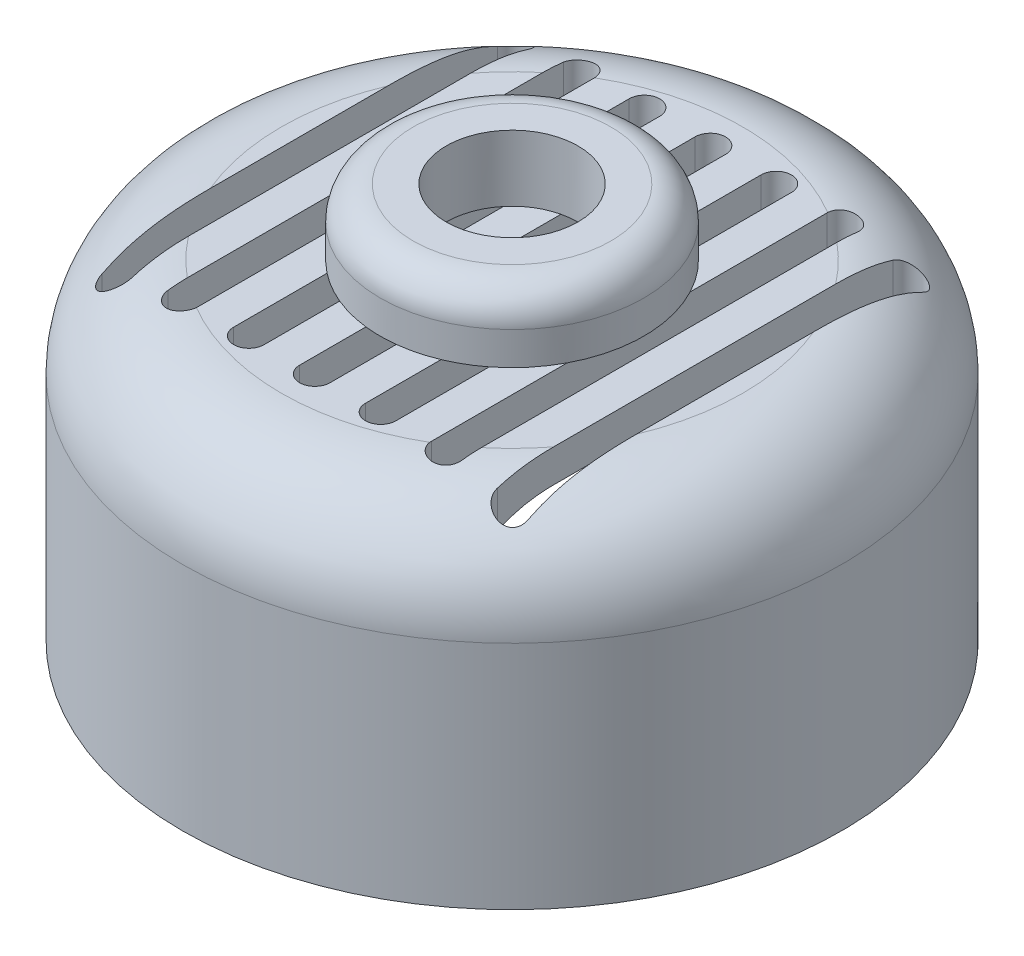
from build123d import *

# Parameters (mm, degrees)
SKETCH1_R           = 50
BOSS_EXTRUDE1_DEPTH = 50
FILLET1_R           = 15
SKETCH2_R           = 20
SKETCH2_R_2         = 10
BOSS_EXTRUDE2_DEPTH = 10
FILLET3_R           = 5
CUT_EXTRUDE1_DEPTH  = 87.602540378
LPATTERN1_COUNT     = 7
LPATTERN1_PITCH     = 10


# Read off the part's stored shape, not the designer's step: Shell1
with BuildPart() as part:
    # Sketch1 → Boss-Extrude1 (new body)
    with BuildSketch(Plane(origin=(0, 0, 0), x_dir=(1, 0, 0), z_dir=(0, 1, 0))):
        with Locations(Location((0, 0, 0), (0, 0, 270))):
            Circle(SKETCH1_R)
    extrude(amount=BOSS_EXTRUDE1_DEPTH)

    # Fillet1
    fillet1_edges = [part.edges().sort_by_distance(p)[0] for p in [
        (0, 50, -50),
    ]]
    fillet(fillet1_edges, radius=FILLET1_R)

    # Sketch2 → Boss-Extrude2 (add)
    with BuildSketch(Plane(origin=(0, 50, 0), x_dir=(1, 0, 0), z_dir=(0, 1, 0))):
        with Locations(Location((0, 0, 0), (0, 0, 270))):
            Circle(SKETCH2_R)
        with Locations(Location((0, 0, 0), (0, 0, 270))):
            Circle(SKETCH2_R_2, mode=Mode.SUBTRACT)
    extrude(amount=BOSS_EXTRUDE2_DEPTH)

    # Fillet3
    fillet3_edges = [part.edges().sort_by_distance(p)[0] for p in [
        (0, 60, -20),
    ]]
    fillet(fillet3_edges, radius=FILLET3_R)

    # Shell1 outline → Shell1 (revolve, cut)
    with BuildSketch(Plane.XY):
        with BuildLine():
            Line((45, 0), (45, 35))
            ThreePointArc((45, 35), (42.071067812, 42.071067812), (35, 45))
            Line((35, 45), (0, 45))
            Line((0, 45), (0, 0))
            Line((0, 0), (45, 0))
        make_face()
    revolve(axis=Axis((0, 0, 0), (0, 1, 0)), mode=Mode.SUBTRACT)

    # Sketch9 → Cut-Extrude1 (cut, through all)
    with BuildSketch(Plane(origin=(0, 50, 0), x_dir=(1, 0, 0), z_dir=(0, 1, 0))):
        with BuildLine():
            Line((32.309592832, 30.074946548), (32.309592832, -29.925053452))
            ThreePointArc((32.309592832, -29.925053452), (30, -32.234646284), (27.690407168, -29.925053452))
            Line((27.690407168, -29.925053452), (27.690407168, 30.074946548))
            ThreePointArc((27.690407168, 30.074946548), (30, 32.38453938), (32.309592832, 30.074946548))
        make_face()
    cut_extrude1 = extrude(amount=-CUT_EXTRUDE1_DEPTH, mode=Mode.SUBTRACT)

    # LPattern1: Cut-Extrude1 ×7
    with Locations(*[(-i * LPATTERN1_PITCH, 0, 0) for i in range(1, LPATTERN1_COUNT)]):
        add(cut_extrude1, mode=Mode.SUBTRACT)


solid = part.part
